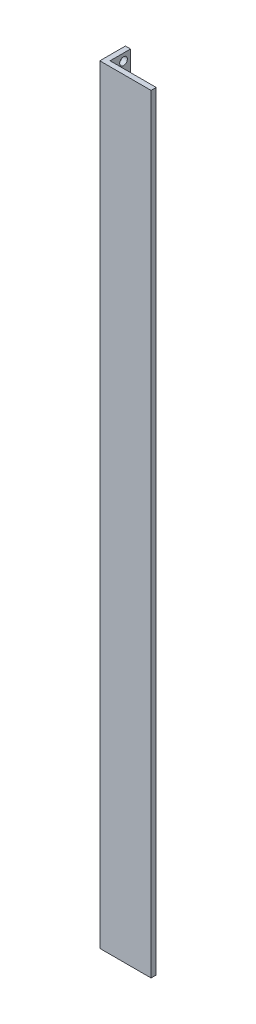
from build123d import *

# Parameters (mm, degrees)
BOSS_EXTRUDE1_DEPTH      = 300
SKETCH2_R                = 1.5
CUT_EXTRUDE1_DEPTH       = 301.83217913
F_3_0_3_DIAMETER_HOLE1_D = 3


with BuildPart() as part:
    # Sketch1 → Boss-Extrude1 (new body)
    with BuildSketch(Plane(origin=(0, 0, 0), x_dir=(1, 0, 0), z_dir=(0, 1, 0))):
        Polygon((0, 0), (0, 10), (2, 10), (2, 2), (20, 2), (20, 0), align=None)
    extrude(amount=BOSS_EXTRUDE1_DEPTH)

    # Sketch2 → Cut-Extrude1 (cut, through all)
    with BuildSketch(Plane.ZY):
        with Locations((-7.262612197, 297.245406858)):
            Circle(SKETCH2_R)
        with Locations((-7.258467028, 88.743438507)):
            Circle(SKETCH2_R)
    extrude(amount=-CUT_EXTRUDE1_DEPTH, mode=Mode.SUBTRACT)

    # Ø3.0 (3) Diameter Hole1 (through all)
    with Locations(Plane(origin=(2, -25.407606404, 52.861996081), x_dir=(0, 0, -1), z_dir=(1, 0, 0))):
        with Locations((58.861996081, 61.407632793), (58.861996081, 37.407632793)):
            Hole(F_3_0_3_DIAMETER_HOLE1_D / 2)


solid = part.part
